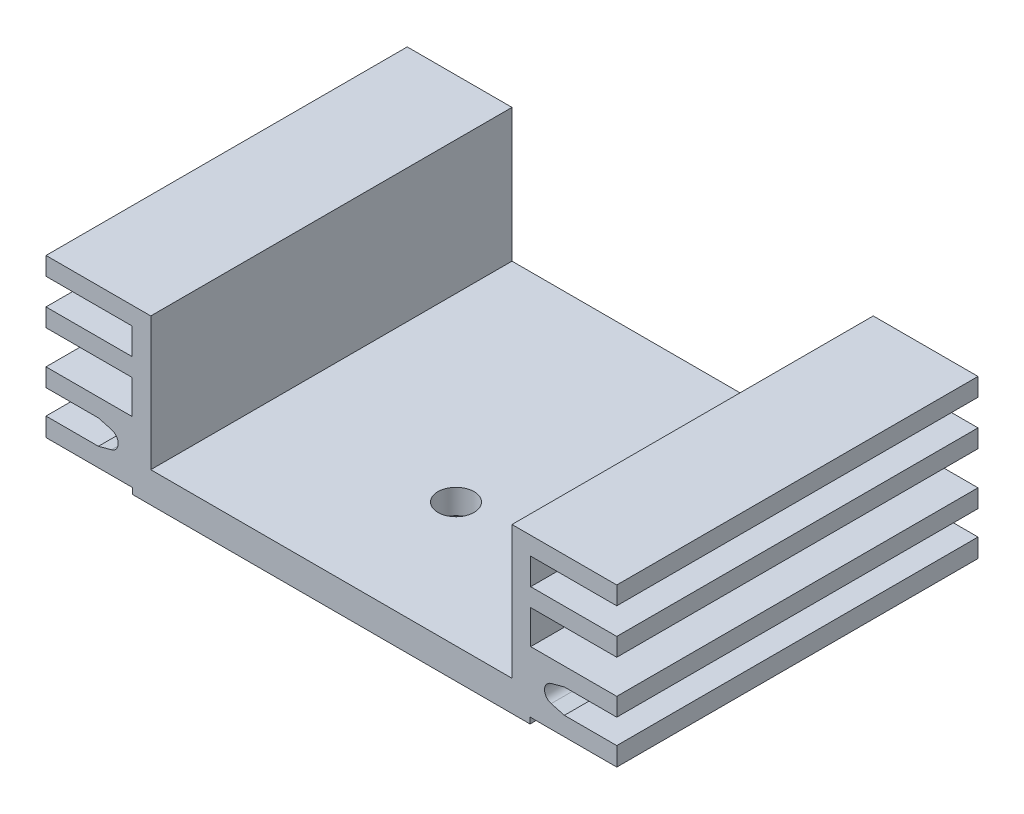
from build123d import *

# Parameters (mm, degrees)
BOSS_EXTRUDE1_DEPTH = 15
SKETCH2_R           = 1.5
CUT_EXTRUDE1_DEPTH  = 32.171300903
CHAMFER1_SIZE       = 0.5


with BuildPart() as part:
    # Sketch1 → Boss-Extrude1 (new, symmetric)
    with BuildSketch(Plane.XY):
        with BuildLine():
            Line((-15, 13.1), (-15, 2.04))
            Line((-15, 2.04), (15, 2.04))
            Line((15, 2.04), (15, 13.1))
            Line((15, 13.1), (23.7, 13.1))
            Line((23.7, 13.1), (23.7, 11.6))
            Line((23.7, 11.6), (16.55, 11.6))
            Line((16.55, 11.6), (16.55, 9.4))
            Line((16.55, 9.4), (23.7, 9.4))
            Line((23.7, 9.4), (23.7, 7.9))
            Line((23.7, 7.9), (16.55, 7.9))
            Line((16.55, 7.9), (16.55, 5.09))
            Line((16.55, 5.09), (23.7, 5.09))
            Line((23.7, 5.09), (23.7, 3.59))
            Line((23.7, 3.59), (19.35, 3.59))
            Line((19.35, 3.59), (18.254412307, 3.294047964))
            ThreePointArc((18.254412307, 3.294047964), (17.7, 2.57), (18.254412307, 1.845952036))
            Line((18.254412307, 1.845952036), (19.35, 1.55))
            Line((19.35, 1.55), (23.7, 1.55))
            Line((23.7, 1.55), (23.7, 0))
            Line((23.7, 0), (16.5, 0))
            Line((16.5, 0), (16.5, -0.5))
            Line((16.5, -0.5), (-16.5, -0.5))
            Line((-16.5, -0.5), (-16.5, 0))
            Line((-16.5, 0), (-23.7, 0))
            Line((-23.7, 0), (-23.7, 1.55))
            Line((-23.7, 1.55), (-19.35, 1.55))
            Line((-19.35, 1.55), (-18.254412307, 1.845952036))
            ThreePointArc((-18.254412307, 1.845952036), (-17.7, 2.57), (-18.254412307, 3.294047964))
            Line((-18.254412307, 3.294047964), (-19.35, 3.59))
            Line((-19.35, 3.59), (-23.7, 3.59))
            Line((-23.7, 3.59), (-23.7, 5.09))
            Line((-23.7, 5.09), (-16.55, 5.09))
            Line((-16.55, 5.09), (-16.55, 7.9))
            Line((-16.55, 7.9), (-23.7, 7.9))
            Line((-23.7, 7.9), (-23.7, 9.4))
            Line((-23.7, 9.4), (-16.55, 9.4))
            Line((-16.55, 9.4), (-16.55, 11.6))
            Line((-16.55, 11.6), (-23.7, 11.6))
            Line((-23.7, 11.6), (-23.7, 13.1))
            Line((-23.7, 13.1), (-15, 13.1))
        make_face()
    extrude(amount=BOSS_EXTRUDE1_DEPTH, both=True)

    # Sketch2 → Cut-Extrude1 (cut, through all)
    with BuildSketch(Plane.XZ.offset(0.5)):
        with Locations((0, 4.65)):
            Circle(SKETCH2_R)
    extrude(amount=-CUT_EXTRUDE1_DEPTH, mode=Mode.SUBTRACT)

    # Chamfer1
    chamfer1_edges = [part.edges().sort_by_distance(p)[0] for p in [
        (-1.5, -0.5, 4.65),
    ]]
    chamfer(chamfer1_edges, length=CHAMFER1_SIZE)


solid = part.part
